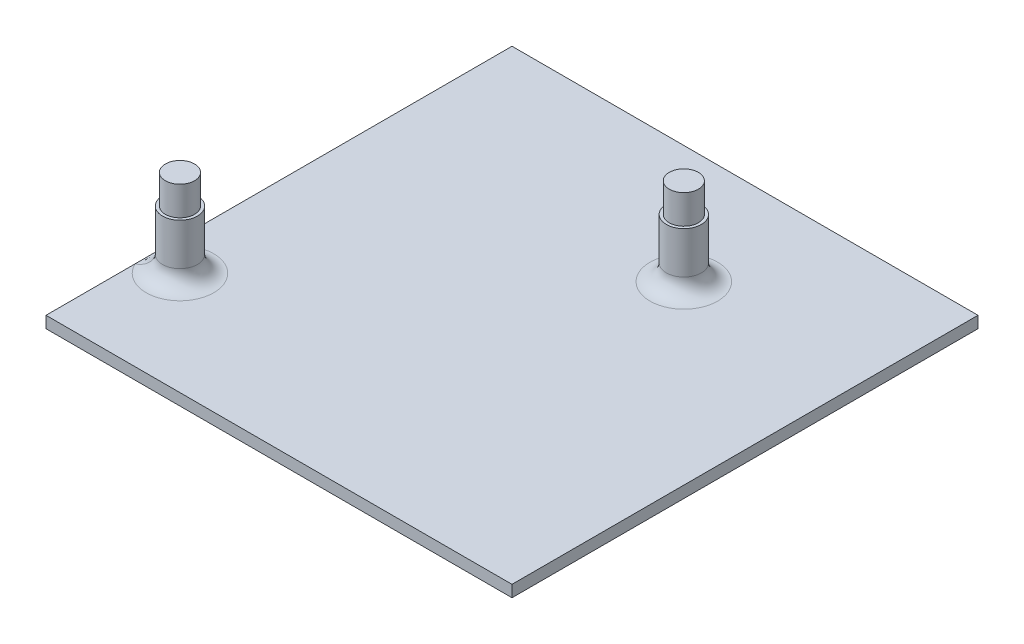
from build123d import *

# Parameters (mm, degrees)
SKETCH1_W           = 80
SKETCH1_H           = 80
BOSS_EXTRUDE1_DEPTH = 2
SKETCH2_R           = 3
BOSS_EXTRUDE2_DEPTH = 10
FILLET1_R           = 2.8
SKETCH3_R           = 2.5
BOSS_EXTRUDE3_DEPTH = 5


with BuildPart() as part:
    # Sketch1 → Boss-Extrude1 (new body)
    with BuildSketch(Plane(origin=(0, 0, 0), x_dir=(1, 0, 0), z_dir=(0, 1, 0))):
        with Locations((12.5, 0)):
            Rectangle(SKETCH1_W, SKETCH1_H)
    extrude(amount=BOSS_EXTRUDE1_DEPTH)

    # Sketch2 → Boss-Extrude2 (add)
    with BuildSketch(Plane(origin=(0, 2, 0), x_dir=(1, 0, 0), z_dir=(0, 1, 0))):
        with Locations((-22.25, -22.25)):
            Circle(SKETCH2_R)
        with Locations((22.25, 19.75)):
            Circle(SKETCH2_R)
    extrude(amount=BOSS_EXTRUDE2_DEPTH)

    # Fillet1
    fillet1_edges = [part.edges().sort_by_distance(p)[0] for p in [
        (19.25, 2, -19.75),
        (-25.25, 2, 22.25),
    ]]
    fillet(fillet1_edges, radius=FILLET1_R)

    # Sketch3 → Boss-Extrude3 (add)
    with BuildSketch(Plane(origin=(0, 12, 0), x_dir=(1, 0, 0), z_dir=(0, 1, 0))):
        with Locations((-22.25, -22.25)):
            Circle(SKETCH3_R)
        with Locations((22.25, 19.75)):
            Circle(SKETCH3_R)
    extrude(amount=BOSS_EXTRUDE3_DEPTH)


solid = part.part
